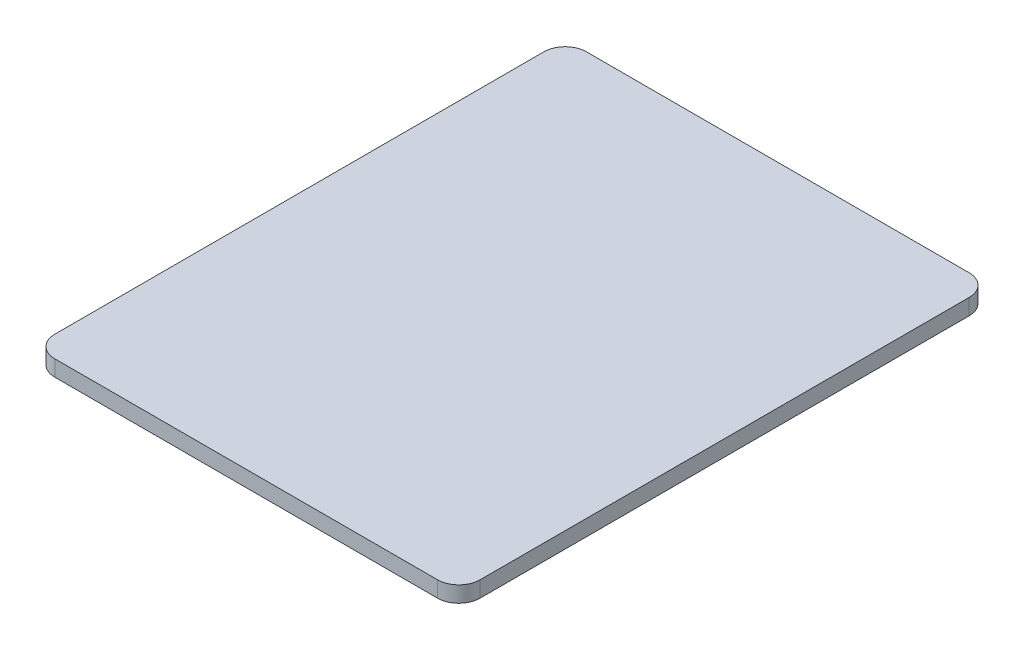
from build123d import *

# Parameters (mm, degrees)
SKETCH_1_W      = 40
SKETCH_1_H      = 50
EXTRUDE_1_DEPTH = 1.5
FILLET_1_R      = 2


with BuildPart() as part:
    # Эскиз1 → Бобышка-Вытянуть1 (new body)
    with BuildSketch(Plane(origin=(0, 0, 0), x_dir=(1, 0, 0), z_dir=(0, 1, 0))):
        Rectangle(SKETCH_1_W, SKETCH_1_H)
    extrude(amount=EXTRUDE_1_DEPTH)

    # Скругление1
    fillet_1_edges = [part.edges().sort_by_distance(p)[0] for p in [
        (-20, 0.75, -25),
        (20, 0.75, -25),
        (-20, 0.75, 25),
        (20, 0.75, 25),
    ]]
    fillet(fillet_1_edges, radius=FILLET_1_R)


solid = part.part
